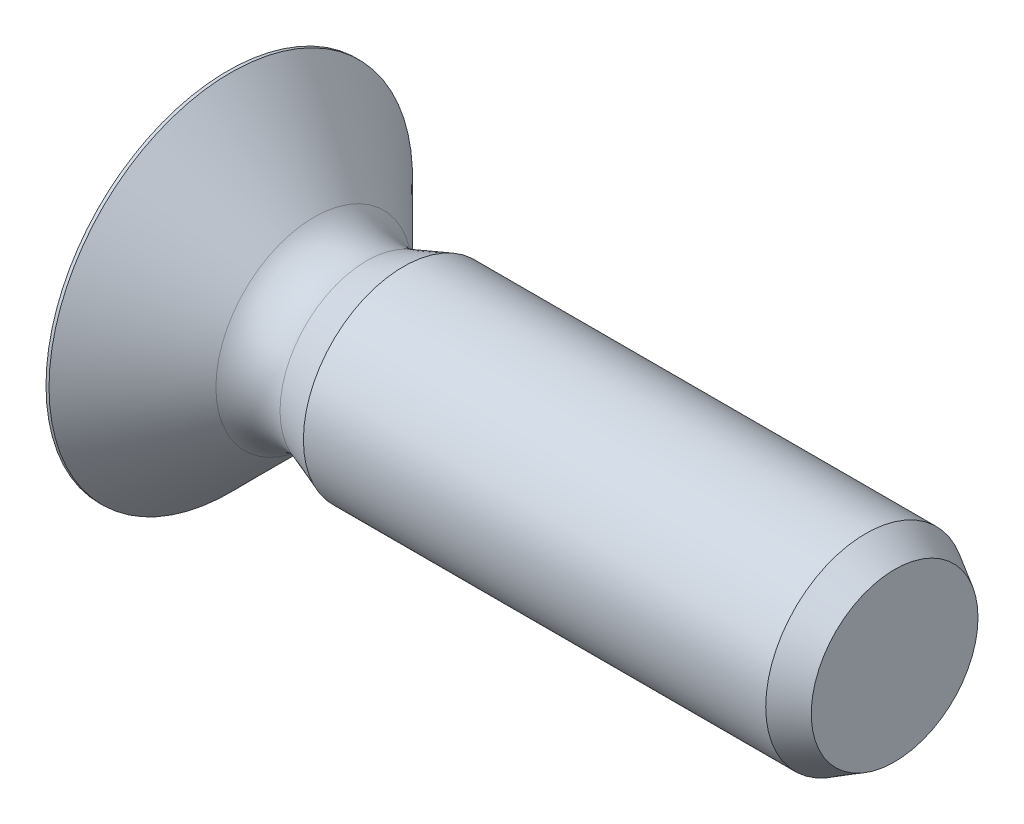
from build123d import *

# Parameters (mm, degrees)
CROSSRECESS_DEPTH = 2.725
DRAFT1_ANGLE      = -45
FILLET1_R         = 1.5


with BuildPart() as part:
    # Sketch1 → Base (revolve)
    with BuildSketch(Plane.XY):
        with BuildLine():
            Line((21.308999111, 0), (21.308999111, 3))
            Line((21.308999111, 3), (6.577940469, 3))
            Line((6.577940469, 3), (4.577940469, 2.272059531))
            Line((4.577940469, 2.272059531), (1.4, 5.45))
            Line((1.4, 5.45), (1.308999111, 5.45))
            ThreePointArc((1.308999111, 5.45), (0.331837963, 2.802497934), (0, 0))
            Line((0, 0), (21.308999111, 0))
        make_face()
    revolve(axis=Axis((-38.105406183, 0, 0), (1, 0, 0)))

    # Sketch2 → BaseEnd (revolve, cut)
    with BuildSketch(Plane(origin=(0, 0, 0), x_dir=(1, 0, 0), z_dir=(0, 1, 0))):
        Polygon((20.442973708, -3), (21.308999111, -2.5), (21.308999111, -3), align=None)
    revolve(axis=Axis((22.637192647, 0, 0), (-1, 0, 0)), mode=Mode.SUBTRACT)

    # Sketch3 → CrossRecess (cut)
    with BuildSketch(Plane.ZY):
        Polygon((0.73, 3.65), (-0.73, 3.65), (-0.73, 0.73), (-3.65, 0.73), (-3.65, -0.73), (-0.73, -0.73), (-0.73, -3.65), (0.73, -3.65), (0.73, -0.73), (3.65, -0.73), (3.65, 0.73), (0.73, 0.73), align=None)
    extrude(amount=-CROSSRECESS_DEPTH, mode=Mode.SUBTRACT)

    # Draft1
    draft1_faces = [part.faces().sort_by_distance(p)[0] for p in [
        (1.65066289, 0, 3.65),
        (1.65066289, 3.65, 0),
        (1.65066289, -3.65, 0),
        (1.65066289, 0, -3.65),
    ]]
    draft(draft1_faces, Plane(origin=(0, 0, 0), x_dir=(0, 0, 1), z_dir=(1, 0, 0)), DRAFT1_ANGLE)

    # Fillet1
    fillet1_edges = [part.edges().sort_by_distance(p)[0] for p in [
        (4.577940469, -2.272059531, 0),
    ]]
    fillet(fillet1_edges, radius=FILLET1_R)


solid = part.part
